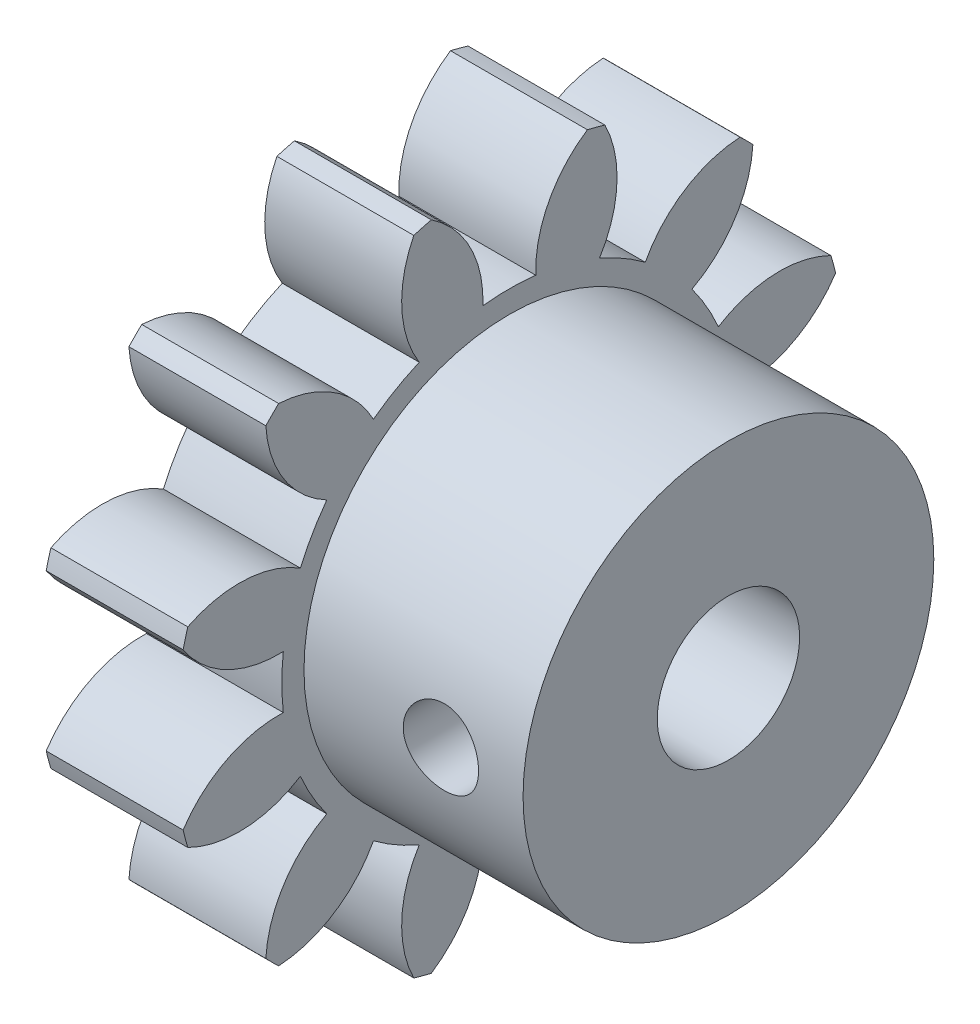
from build123d import *

# Parameters (mm, degrees)
METRIC_SPUR_GEAR_1_75M_12T_20PA_5FW_OU_R  = 2.5
METRIC_SPUR_GEAR_1_75M_12T_20PA_5FW_DEPTH = 5
SKETCH2_R                                 = 7.5
SKETCH2_R_2                               = 2.5
BOSS_EXTRUDE1_DEPTH                       = 13
SKETCH3_R                                 = 1.375
CUT_EXTRUDE1_DEPTH                        = 13
CUT_EXTRUDE2_DEPTH                        = 22.281227002
CUT_EXTRUDE2_DEPTH_BACK                   = 22.281227002
SKETCH4_R                                 = 2.6


# Read off the part's stored shape, not the designer's step: Metric - Spur gear 1.75M 12T 20PA 5FW ---S12N75H50L5N
with BuildPart() as part:
    # Metric - Spur gear 1.75M 12T 20PA 5FW ou → Metric - Spur gear 1.75M 12T 20PA 5FW (new body)
    with BuildSketch(Plane.YZ):
        with BuildLine():
            ThreePointArc((8.893362097, 8.424405653), (8.66205807, 8.66205807), (8.424405653, 8.893362097))
            ThreePointArc((8.424405653, 8.893362097), (6.40252905, 8.232977147), (4.963463004, 6.666713378))
            ThreePointArc((4.963463004, 6.666713378), (4.15575, 7.197970144), (3.291811643, 7.631841741))
            ThreePointArc((3.291811643, 7.631841741), (3.928702834, 9.661241379), (3.489674675, 11.742430356))
            ThreePointArc((3.489674675, 11.742430356), (3.170533302, 11.832591372), (2.849068258, 11.914080328))
            ThreePointArc((2.849068258, 11.914080328), (1.428264232, 10.331231883), (0.965128363, 8.255274647))
            ThreePointArc((0.965128363, 8.255274647), (0, 8.3115), (-0.965128363, 8.255274647))
            ThreePointArc((-0.965128363, 8.255274647), (-1.428264232, 10.331231883), (-2.849068258, 11.914080328))
            ThreePointArc((-2.849068258, 11.914080328), (-3.170533302, 11.832591372), (-3.489674675, 11.742430356))
            ThreePointArc((-3.489674675, 11.742430356), (-3.928702834, 9.661241379), (-3.291811643, 7.631841741))
            ThreePointArc((-3.291811643, 7.631841741), (-4.15575, 7.197970144), (-4.963463004, 6.666713378))
            ThreePointArc((-4.963463004, 6.666713378), (-6.40252905, 8.232977147), (-8.424405653, 8.893362097))
            ThreePointArc((-8.424405653, 8.893362097), (-8.66205807, 8.66205807), (-8.893362097, 8.424405653))
            ThreePointArc((-8.893362097, 8.424405653), (-8.232977147, 6.40252905), (-6.666713378, 4.963463004))
            ThreePointArc((-6.666713378, 4.963463004), (-7.197970144, 4.15575), (-7.631841741, 3.291811643))
            ThreePointArc((-7.631841741, 3.291811643), (-9.661241379, 3.928702834), (-11.742430356, 3.489674675))
            ThreePointArc((-11.742430356, 3.489674675), (-11.832591372, 3.170533302), (-11.914080328, 2.849068258))
            ThreePointArc((-11.914080328, 2.849068258), (-10.331231883, 1.428264232), (-8.255274647, 0.965128363))
            ThreePointArc((-8.255274647, 0.965128363), (-8.3115, 0), (-8.255274647, -0.965128363))
            ThreePointArc((-8.255274647, -0.965128363), (-10.331231883, -1.428264232), (-11.914080328, -2.849068258))
            ThreePointArc((-11.914080328, -2.849068258), (-11.832591372, -3.170533302), (-11.742430356, -3.489674675))
            ThreePointArc((-11.742430356, -3.489674675), (-9.661241379, -3.928702834), (-7.631841741, -3.291811643))
            ThreePointArc((-7.631841741, -3.291811643), (-7.197970144, -4.15575), (-6.666713378, -4.963463004))
            ThreePointArc((-6.666713378, -4.963463004), (-8.232977147, -6.40252905), (-8.893362097, -8.424405653))
            ThreePointArc((-8.893362097, -8.424405653), (-8.66205807, -8.66205807), (-8.424405653, -8.893362097))
            ThreePointArc((-8.424405653, -8.893362097), (-6.40252905, -8.232977147), (-4.963463004, -6.666713378))
            ThreePointArc((-4.963463004, -6.666713378), (-4.15575, -7.197970144), (-3.291811643, -7.631841741))
            ThreePointArc((-3.291811643, -7.631841741), (-3.928702834, -9.661241379), (-3.489674675, -11.742430356))
            ThreePointArc((-3.489674675, -11.742430356), (-3.170533302, -11.832591372), (-2.849068258, -11.914080328))
            ThreePointArc((-2.849068258, -11.914080328), (-1.428264232, -10.331231883), (-0.965128363, -8.255274647))
            ThreePointArc((-0.965128363, -8.255274647), (0, -8.3115), (0.965128363, -8.255274647))
            ThreePointArc((0.965128363, -8.255274647), (1.428264232, -10.331231883), (2.849068258, -11.914080328))
            ThreePointArc((2.849068258, -11.914080328), (3.170533302, -11.832591372), (3.489674675, -11.742430356))
            ThreePointArc((3.489674675, -11.742430356), (3.928702834, -9.661241379), (3.291811643, -7.631841741))
            ThreePointArc((3.291811643, -7.631841741), (4.15575, -7.197970144), (4.963463004, -6.666713378))
            ThreePointArc((4.963463004, -6.666713378), (6.40252905, -8.232977147), (8.424405653, -8.893362097))
            ThreePointArc((8.424405653, -8.893362097), (8.66205807, -8.66205807), (8.893362097, -8.424405653))
            ThreePointArc((8.893362097, -8.424405653), (8.232977147, -6.40252905), (6.666713378, -4.963463004))
            ThreePointArc((6.666713378, -4.963463004), (7.197970144, -4.15575), (7.631841741, -3.291811643))
            ThreePointArc((7.631841741, -3.291811643), (9.661241379, -3.928702834), (11.742430356, -3.489674675))
            ThreePointArc((11.742430356, -3.489674675), (11.832591372, -3.170533302), (11.914080328, -2.849068258))
            ThreePointArc((11.914080328, -2.849068258), (10.331231883, -1.428264232), (8.255274647, -0.965128363))
            ThreePointArc((8.255274647, -0.965128363), (8.3115, 0), (8.255274647, 0.965128363))
            ThreePointArc((8.255274647, 0.965128363), (10.331231883, 1.428264232), (11.914080328, 2.849068258))
            ThreePointArc((11.914080328, 2.849068258), (11.832591372, 3.170533302), (11.742430356, 3.489674675))
            ThreePointArc((11.742430356, 3.489674675), (9.661241379, 3.928702834), (7.631841741, 3.291811643))
            ThreePointArc((7.631841741, 3.291811643), (7.197970144, 4.15575), (6.666713378, 4.963463004))
            ThreePointArc((6.666713378, 4.963463004), (8.232977147, 6.40252905), (8.893362097, 8.424405653))
        make_face()
        Circle(METRIC_SPUR_GEAR_1_75M_12T_20PA_5FW_OU_R, mode=Mode.SUBTRACT)
    extrude(amount=METRIC_SPUR_GEAR_1_75M_12T_20PA_5FW_DEPTH)

    # Sketch2 → Boss-Extrude1 (add)
    with BuildSketch(Plane(origin=(0, 0, 0), x_dir=(0, 0, -1), z_dir=(1, 0, 0))):
        with Locations(Location((0, 0, 0), (0, 0, 180))):
            Circle(SKETCH2_R)
        Circle(SKETCH2_R_2, mode=Mode.SUBTRACT)
    extrude(amount=BOSS_EXTRUDE1_DEPTH)

    # Sketch3 → Cut-Extrude1 (cut)
    with BuildSketch(Plane.XY):
        with Locations((10, 0)):
            Circle(SKETCH3_R)
    extrude(amount=CUT_EXTRUDE1_DEPTH, mode=Mode.SUBTRACT)

    # Sketch4 → Cut-Extrude2 (cut, two sides: drawn at the far end of the back side and taken through both)
    with BuildSketch(Plane(origin=(0, 0, 0), x_dir=(0, 0, -1), z_dir=(1, 0, 0)).offset(-CUT_EXTRUDE2_DEPTH_BACK)):
        Circle(SKETCH4_R)
    extrude(amount=CUT_EXTRUDE2_DEPTH + CUT_EXTRUDE2_DEPTH_BACK, mode=Mode.SUBTRACT)


solid = part.part
